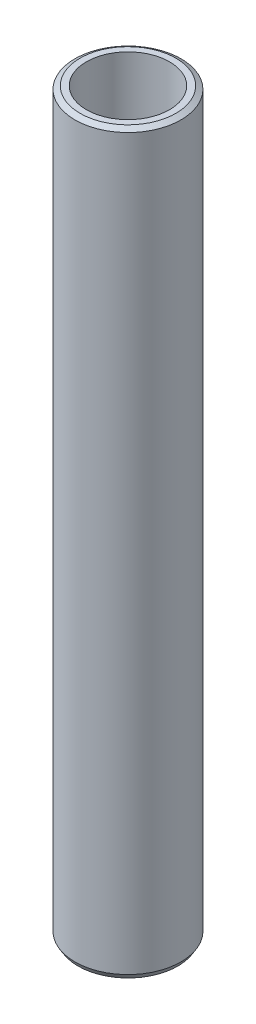
from build123d import *
from OCP.BRepFilletAPI import BRepFilletAPI_MakeChamfer

# Parameters (mm, degrees)
SKETCH1_R           = 37.5
BOSS_EXTRUDE1_DEPTH = 521.538332557
SKETCH2_R           = 29.392682967
CUT_EXTRUDE1_DEPTH  = 525.227748528
CHAMFER1_SIZE       = 2.169775554
CHAMFER1_SIZE2      = 3.63211083


with BuildPart() as part:
    # Sketch1 → Boss-Extrude1 (new body)
    with BuildSketch(Plane(origin=(0, 0, 0), x_dir=(1, 0, 0), z_dir=(0, 1, 0))):
        Circle(SKETCH1_R)
    extrude(amount=BOSS_EXTRUDE1_DEPTH)

    # Sketch2 → Cut-Extrude1 (cut, through all)
    with BuildSketch(Plane(origin=(0, 0, 0), x_dir=(1, 0, 0), z_dir=(0, 1, 0))):
        Circle(SKETCH2_R)
    extrude(amount=CUT_EXTRUDE1_DEPTH, mode=Mode.SUBTRACT)

    # Chamfer1: one chamfer whose edges measure the first distance from different faces: ONE call of the kernel's chamfer builder (chamfer() names one face for all edges)
    chamfer1_edges_1 = [part.edges().sort_by_distance(p)[0] for p in [
        (-37.5, 521.538332557, 0),
    ]]
    chamfer1_side_1 = [part.faces().sort_by_distance(p)[0] for p in [
        (-37.5, 260.769166279, 0),
    ]]
    chamfer1_edges_2 = [part.edges().sort_by_distance(p)[0] for p in [
        (-37.5, 0, 0),
    ]]
    chamfer1_side_2 = [part.faces().sort_by_distance(p)[0] for p in [
        (-36.439339828, 0, 0),
    ]]
    chamfer1 = BRepFilletAPI_MakeChamfer(part.part.solid().wrapped)
    for e in chamfer1_edges_1:
        chamfer1.Add(CHAMFER1_SIZE, CHAMFER1_SIZE2, e.wrapped, chamfer1_side_1[0].wrapped)  # the first distance lies on this face
    for e in chamfer1_edges_2:
        chamfer1.Add(CHAMFER1_SIZE, CHAMFER1_SIZE2, e.wrapped, chamfer1_side_2[0].wrapped)  # the first distance lies on this face
    add(Compound.cast(chamfer1.Shape()), mode=Mode.REPLACE)


solid = part.part
